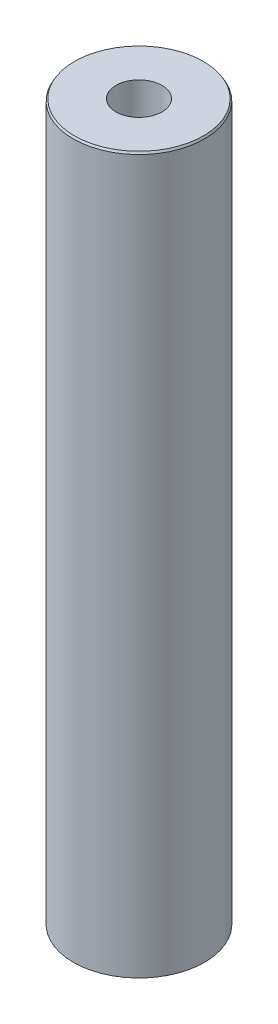
from build123d import *
from OCP.BRepFilletAPI import BRepFilletAPI_MakeChamfer

# Parameters (mm, degrees)
SKETCH1_R           = 55
BOSS_EXTRUDE1_DEPTH = 600
SKETCH2_R           = 19.278740834
CUT_EXTRUDE1_DEPTH  = 606.020660804
CHAMFER1_SIZE       = 1.702178287
CHAMFER1_SIZE2      = 0.982753092


with BuildPart() as part:
    # Sketch1 → Boss-Extrude1 (new body)
    with BuildSketch(Plane(origin=(0, 0, 0), x_dir=(1, 0, 0), z_dir=(0, 1, 0))):
        Circle(SKETCH1_R)
    extrude(amount=BOSS_EXTRUDE1_DEPTH)

    # Sketch2 → Cut-Extrude1 (cut, through all)
    with BuildSketch(Plane(origin=(0, 0, 0), x_dir=(1, 0, 0), z_dir=(0, 1, 0))):
        Circle(SKETCH2_R)
    extrude(amount=CUT_EXTRUDE1_DEPTH, mode=Mode.SUBTRACT)

    # Chamfer1: one chamfer whose edges measure the first distance from different faces: ONE call of the kernel's chamfer builder (chamfer() names one face for all edges)
    chamfer1_edges_1 = [part.edges().sort_by_distance(p)[0] for p in [
        (-55, 600, 0),
    ]]
    chamfer1_side_1 = [part.faces().sort_by_distance(p)[0] for p in [
        (-55, 300, 0),
    ]]
    chamfer1_edges_2 = [part.edges().sort_by_distance(p)[0] for p in [
        (-55, 0, 0),
    ]]
    chamfer1_side_2 = [part.faces().sort_by_distance(p)[0] for p in [
        (-53.444365081, 0, 0),
    ]]
    chamfer1 = BRepFilletAPI_MakeChamfer(part.part.solid().wrapped)
    for e in chamfer1_edges_1:
        chamfer1.Add(CHAMFER1_SIZE, CHAMFER1_SIZE2, e.wrapped, chamfer1_side_1[0].wrapped)  # the first distance lies on this face
    for e in chamfer1_edges_2:
        chamfer1.Add(CHAMFER1_SIZE, CHAMFER1_SIZE2, e.wrapped, chamfer1_side_2[0].wrapped)  # the first distance lies on this face
    add(Compound.cast(chamfer1.Shape()), mode=Mode.REPLACE)


solid = part.part
